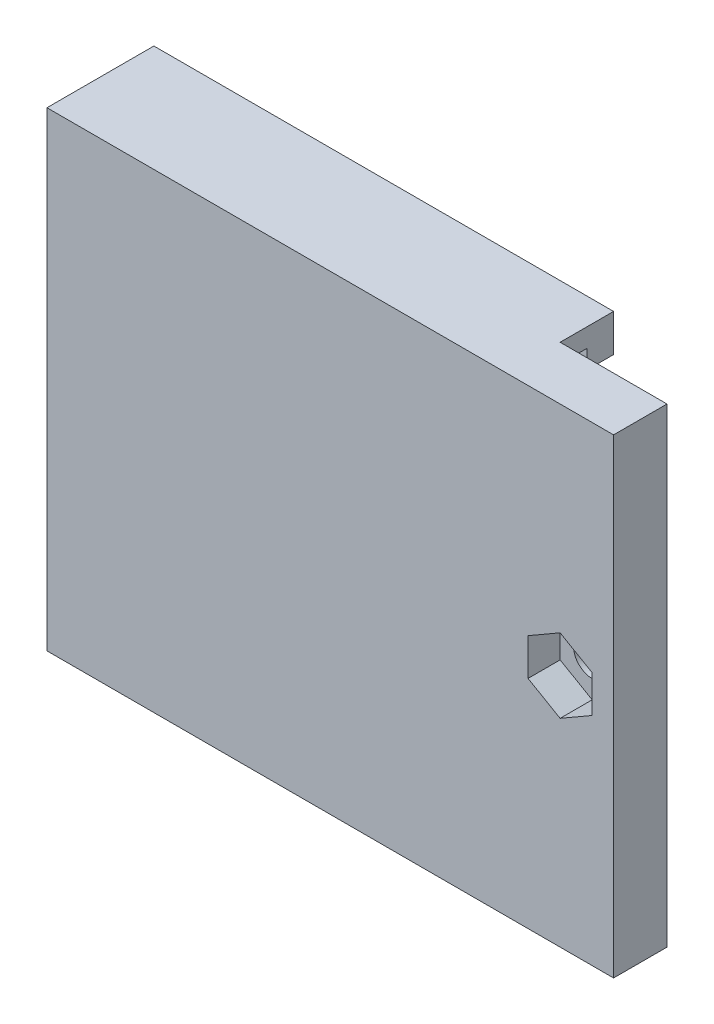
from build123d import *

# Parameters (mm, degrees)
CROQUIS1_W              = 53
CROQUIS1_H              = 44
CROQUIS1_R              = 1.75
SALIENTE_EXTRUIR1_DEPTH = 5
CORTAR_EXTRUIR1_DEPTH   = 3
CROQUIS3_W              = 43
CROQUIS3_H              = 1.75
SALIENTE_EXTRUIR2_DEPTH = 5
CROQUIS4_W              = 43
CROQUIS4_H              = 1.75
SALIENTE_EXTRUIR3_DEPTH = 2.5
CROQUIS5_W              = 7.5
CROQUIS5_H              = 8
CORTAR_EXTRUIR2_DEPTH   = 1.5


with BuildPart() as part:
    # Croquis1 → Saliente-Extruir1 (new body)
    with BuildSketch(Plane.XY):
        Rectangle(CROQUIS1_W, CROQUIS1_H)
        with Locations((21.5, 0)):
            Circle(CROQUIS1_R, mode=Mode.SUBTRACT)
    extrude(amount=SALIENTE_EXTRUIR1_DEPTH)

    # Croquis2 → Cortar-Extruir1 (cut)
    with BuildSketch(Plane.XY.offset(5)):
        Polygon((21.5, -3.464101615), (24.5, -1.732050808), (24.5, 1.732050808), (21.5, 3.464101615), (18.5, 1.732050808), (18.5, -1.732050808), align=None)
    extrude(amount=-CORTAR_EXTRUIR1_DEPTH, mode=Mode.SUBTRACT)

    # Croquis3 → Saliente-Extruir2 (add)
    with BuildSketch(Plane(origin=(0, 0, 0), x_dir=(-1, 0, 0), z_dir=(0, 0, -1))):
        with Locations((5, -21.125)):
            Rectangle(CROQUIS3_W, CROQUIS3_H)
        with Locations((5, 21.125)):
            Rectangle(CROQUIS3_W, CROQUIS3_H)
    extrude(amount=SALIENTE_EXTRUIR2_DEPTH)

    # Croquis4 → Saliente-Extruir3 (add)
    with BuildSketch(Plane(origin=(0, 0, -5), x_dir=(-1, 0, 0), z_dir=(0, 0, -1))):
        with Locations((5, -19.375)):
            Rectangle(CROQUIS4_W, CROQUIS4_H)
        with Locations((5, 19.375)):
            Rectangle(CROQUIS4_W, CROQUIS4_H)
    extrude(amount=-SALIENTE_EXTRUIR3_DEPTH)

    # Croquis5 → Cortar-Extruir2 (cut)
    with BuildSketch(Plane(origin=(0, 0, 0), x_dir=(-1, 0, 0), z_dir=(0, 0, -1))):
        with Locations((22.75, 0)):
            Rectangle(CROQUIS5_W, CROQUIS5_H)
    extrude(amount=-CORTAR_EXTRUIR2_DEPTH, mode=Mode.SUBTRACT)


solid = part.part
